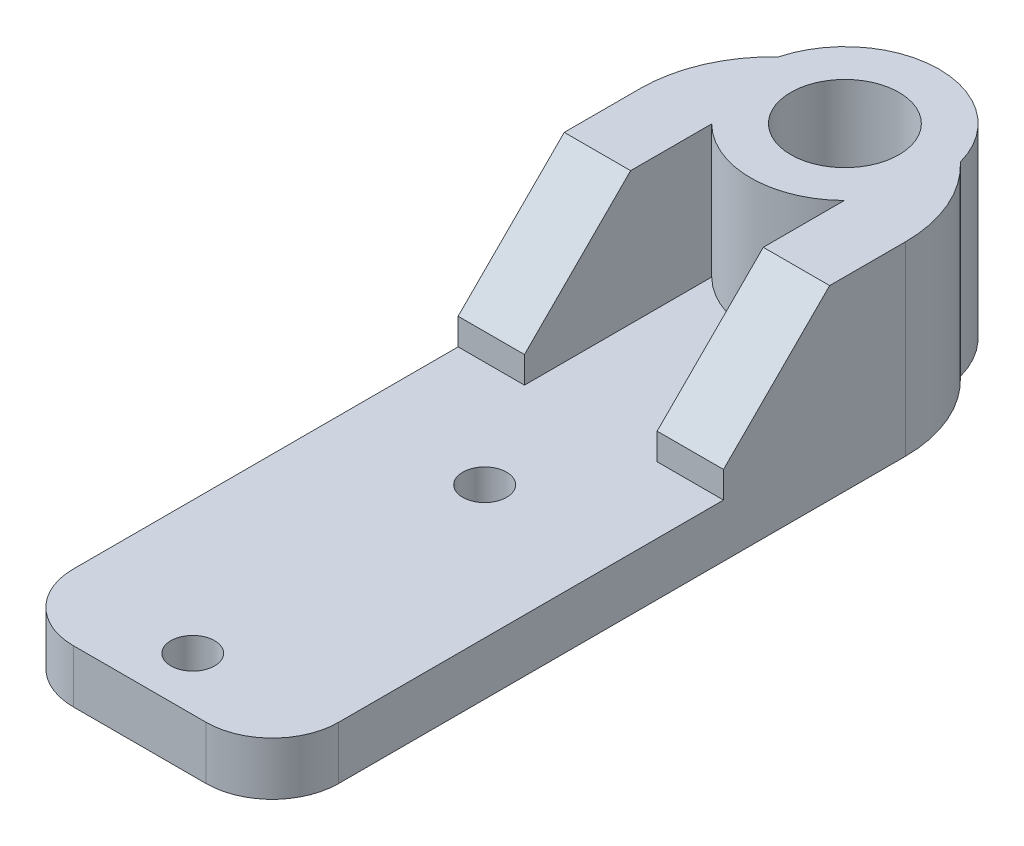
from build123d import *
from build123d.topology import SkipClean

# Parameters (mm, degrees)
SKETCH1_W                       = 20
SKETCH1_H                       = 55
BOSS_EXTRUDE1_DEPTH             = 4
CUT_EXTRUDE1_DEPTH              = 30.533878851
CUT_EXTRUDE1_DEPTH_BACK         = 30.533878851
SKETCH2_R                       = 4.075
SKETCH3_R                       = 7.1
SKETCH3_R_2                     = 4.075
BOSS_EXTRUDE2_DEPTH             = 10
BOSS_EXTRUDE2_DIRECTION_2_REACH = 31.534
SKETCH4_W                       = 21
SKETCH4_H                       = 14
BOSS_EXTRUDE3_DEPTH             = 5
CHAMFER1_SIZE                   = 8
CHAMFER1_OF_MIRROR1_SIZE        = 8
FILLET3_R                       = 10
FILLET4_R                       = 5
SKETCH5_R                       = 1.65
CUT_EXTRUDE2_DEPTH              = 36.672993987


with BuildPart() as part:
    # Sketch1 → Boss-Extrude1 (new body)
    with BuildSketch(Plane(origin=(0, 0, 0), x_dir=(1, 0, 0), z_dir=(0, 1, 0))):
        Rectangle(SKETCH1_W, SKETCH1_H)
    extrude(amount=BOSS_EXTRUDE1_DEPTH)

    # Sketch2 → Cut-Extrude1 (cut, two sides: drawn at the far end of the back side and taken through both)
    with BuildSketch(Plane(origin=(0, 4, 0), x_dir=(1, 0, 0), z_dir=(0, 1, 0)).offset(-CUT_EXTRUDE1_DEPTH_BACK)):
        with Locations((0, 25.65)):
            Circle(SKETCH2_R)
    extrude(amount=CUT_EXTRUDE1_DEPTH + CUT_EXTRUDE1_DEPTH_BACK, mode=Mode.SUBTRACT)

    # Sketch3 → Boss-Extrude2 (add)
    with BuildSketch(Plane(origin=(0, 4, 0), x_dir=(1, 0, 0), z_dir=(0, 1, 0))):
        with Locations(Location((0, 25.65, 0), (0, 0, 270))):
            Circle(SKETCH3_R)
        with Locations(Location((0, 25.65, 0), (0, 0, 270))):
            Circle(SKETCH3_R_2, mode=Mode.SUBTRACT)
    extrude(amount=BOSS_EXTRUDE2_DEPTH)

    # Boss-Extrude2 direction 2: up to this face of the body (flat: up to its plane)
    boss_extrude2_direction_2_end = Plane(part.part.faces().sort_by_distance((0, 0, 0.953538914))[0])
    # Sketch3 → Boss-Extrude2 direction 2 (add, up to the picked face)
    with BuildSketch(Plane(origin=(0, 4, 0), x_dir=(1, 0, 0), z_dir=(0, 1, 0)), mode=Mode.PRIVATE) as boss_extrude2_direction_2_sk1:
        with Locations(Location((0, 25.65, 0), (0, 0, 270))):
            Circle(SKETCH3_R)
        with Locations(Location((0, 25.65, 0), (0, 0, 270))):
            Circle(SKETCH3_R_2, mode=Mode.SUBTRACT)
    boss_extrude2_direction_2_tool1 = split(extrude(boss_extrude2_direction_2_sk1.sketch, amount=-BOSS_EXTRUDE2_DIRECTION_2_REACH, mode=Mode.PRIVATE), bisect_by=boss_extrude2_direction_2_end, keep=Keep.BOTH, mode=Mode.PRIVATE)
    add(boss_extrude2_direction_2_tool1.solids().sort_by(Axis((0, 4, -32.549182), (0, -1, 0)))[0])

    # Sketch4 → Boss-Extrude3 (add)
    with BuildSketch(Plane(origin=(10, 0, 0), x_dir=(0, 0, -1), z_dir=(1, 0, 0))):
        with Locations((17, 7)):
            Rectangle(SKETCH4_W, SKETCH4_H)
    boss_extrude3 = extrude(amount=-BOSS_EXTRUDE3_DEPTH)

    # Chamfer1
    chamfer1_edges = [part.edges().sort_by_distance(p)[0] for p in [
        (7.5, 14, -6.5),
    ]]
    chamfer(chamfer1_edges, length=CHAMFER1_SIZE)

    # Mirror1: Boss-Extrude3 across plane
    with SkipClean():  # the faces are left unmerged after this step: merging them gives an invalid solid
        add(boss_extrude3.mirror(Plane(origin=(0, 0, 0), x_dir=(0, 0, 1), z_dir=(1, 0, 0))))

    # Chamfer1 of Mirror1
    chamfer1_of_mirror1_edges = [part.edges().sort_by_distance(p)[0] for p in [
        (-7.5, 14, -6.5),
    ]]
    chamfer(chamfer1_of_mirror1_edges, length=CHAMFER1_OF_MIRROR1_SIZE)

    # Fillet3
    # the kernel refuses this fillet: 10 mm, written as the material it takes off along each edge
    with BuildSketch(Plane(origin=(10, 32.202420855, -27.5), x_dir=(0, 0, 1), z_dir=(0, -1, 0))) as fillet3_piece_1:
        with BuildLine():
            CenterArc((7.280968342, 10), FILLET3_R, 223.272918663, 46.727081337)
            Line((0, 3.145257116), (-0.145619367, 3.008162259))
            ThreePointArc((-0.145619367, 3.008162259), (-0.2, 1.572628558), (-0.2, 0))
            Line((-0.2, 0), (0, -0.2))
            Line((0, -0.2), (7.280968342, -0.2))
            Line((7.280968342, -0.2), (7.280968342, 0))
        make_face()
    extrude(amount=28.202420855, mode=Mode.SUBTRACT)
    with BuildSketch(Plane(origin=(-10, 32.202420855, -27.5), x_dir=(0, 0, 1), z_dir=(0, -1, 0))) as fillet3_piece_2:
        with BuildLine():
            CenterArc((7.280968342, -10), FILLET3_R, 90, 46.727081337)
            Line((0, -3.145257116), (-0.145619367, -3.008162259))
            ThreePointArc((-0.145619367, -3.008162259), (-0.2, -1.572628558), (-0.2, 0))
            Line((-0.2, 0), (0, 0.2))
            Line((0, 0.2), (7.280968342, 0.2))
            Line((7.280968342, 0.2), (7.280968342, 0))
        make_face()
    extrude(amount=28.202420855, mode=Mode.SUBTRACT)
    with BuildSketch(Plane(origin=(-10, -18.202420855, -27.5), x_dir=(0, 0, 1), z_dir=(0, 1, 0))) as fillet3_piece_3:
        with BuildLine():
            CenterArc((7.280968342, 10), FILLET3_R, 223.272918663, 46.727081337)
            Line((0, 3.145257116), (-0.145619367, 3.008162259))
            ThreePointArc((-0.145619367, 3.008162259), (-0.2, 1.572628558), (-0.2, 0))
            Line((-0.2, 0), (0, -0.2))
            Line((0, -0.2), (7.280968342, -0.2))
            Line((7.280968342, -0.2), (7.280968342, 0))
        make_face()
    extrude(amount=22.202420855, mode=Mode.SUBTRACT)
    with BuildSketch(Plane(origin=(10, -18.202420855, -27.5), x_dir=(0, 0, 1), z_dir=(0, 1, 0))) as fillet3_piece_4:
        with BuildLine():
            CenterArc((7.280968342, -10), FILLET3_R, 90, 46.727081337)
            Line((0, -3.145257116), (-0.145619367, -3.008162259))
            ThreePointArc((-0.145619367, -3.008162259), (-0.2, -1.572628558), (-0.2, 0))
            Line((-0.2, 0), (0, 0.2))
            Line((0, 0.2), (7.280968342, 0.2))
            Line((7.280968342, 0.2), (7.280968342, 0))
        make_face()
    extrude(amount=22.202420855, mode=Mode.SUBTRACT)

    # Fillet4
    fillet4_edges = [part.edges().sort_by_distance(p)[0] for p in [
        (10, 2, 27.5),
        (-10, 2, 27.5),
    ]]
    fillet(fillet4_edges, radius=FILLET4_R)

    # Sketch5 → Cut-Extrude2 (cut, through all)
    with BuildSketch(Plane(origin=(0, 4, 0), x_dir=(1, 0, 0), z_dir=(0, 1, 0))):
        with Locations(Location((0, -23.5, 0), (0, 0, 270))):
            Circle(SKETCH5_R)
        with Locations(Location((0, -1.5, 0), (0, 0, 270))):
            Circle(SKETCH5_R)
    extrude(amount=-CUT_EXTRUDE2_DEPTH, mode=Mode.SUBTRACT)


solid = part.part
